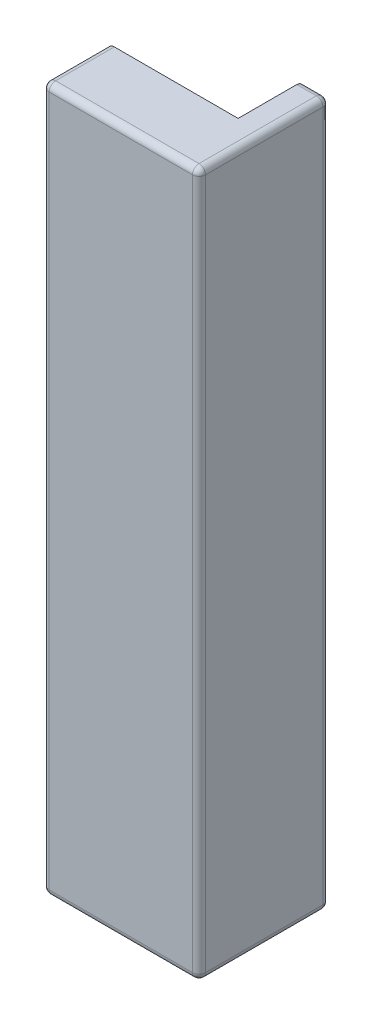
from build123d import *

# Parameters (mm, degrees)
SKETCH_1_W          = 12
SKETCH_1_H          = 54
EXTRUDE_1_DEPTH     = 10
SKETCH_2_W          = 8
SKETCH_2_H          = 50
CUT_EXTRUDE_1_DEPTH = 10
SKETCH_3_W          = 13.565938191
SKETCH_3_H          = 57.788760324
CUT_EXTRUDE_2_DEPTH = 10
SKETCH_4_W          = 3
SKETCH_4_H          = 50
CUT_EXTRUDE_3_DEPTH = 1
FILLET_1_R          = 0.5


with BuildPart() as part:
    # 草圖1 → 填料-伸長1 (new body)
    with BuildSketch(Plane.XY):
        with Locations((-24.897904343, -6.146542517)):
            Rectangle(SKETCH_1_W, SKETCH_1_H)
    extrude(amount=EXTRUDE_1_DEPTH)

    # 草圖2 → 除料-伸長1 (cut)
    with BuildSketch(Plane.ZY.offset(30.897904343)):
        with Locations((4, -6.146542517)):
            Rectangle(SKETCH_2_W, SKETCH_2_H)
    extrude(amount=-CUT_EXTRUDE_1_DEPTH, mode=Mode.SUBTRACT)

    # 草圖3 → 除料-伸長2 (cut)
    with BuildSketch(Plane.ZY.offset(30.897904343)):
        with Locations((-1.782969096, -5.724817648)):
            Rectangle(SKETCH_3_W, SKETCH_3_H)
    extrude(amount=-CUT_EXTRUDE_2_DEPTH, mode=Mode.SUBTRACT)

    # 草圖4 → 除料-伸長3 (cut)
    with BuildSketch(Plane.ZY.offset(20.897904343)):
        with Locations((6.5, -6.146542517)):
            Rectangle(SKETCH_4_W, SKETCH_4_H)
    extrude(amount=-CUT_EXTRUDE_3_DEPTH, mode=Mode.SUBTRACT)

    # 圓角1
    fillet_1_edges = [part.edges().sort_by_distance(p)[0] for p in [
        (-24.897904343, 20.853457483, 10),
        (-30.897904343, -6.146542517, 10),
        (-30.897904343, -6.146542517, 8),
        (-30.897904343, 18.853457483, 6.5),
        (-30.897904343, -31.146542517, 6.5),
        (-19.897904343, 20.853457483, 0),
        (-19.897904343, -33.146542517, 0),
        (-24.897904343, -33.146542517, 10),
        (-18.897904343, -6.146542517, 0),
        (-19.897904343, -6.146542517, 8),
        (-19.897904343, -31.146542517, 6.5),
        (-19.897904343, -6.146542517, 5),
        (-19.897904343, 18.853457483, 6.5),
        (-20.897904343, -6.146542517, 5),
        (-30.897904343, -33.146542517, 7.5),
        (-30.897904343, 20.853457483, 7.5),
        (-18.897904343, 20.853457483, 5),
        (-18.897904343, -33.146542517, 5),
        (-18.897904343, -6.146542517, 10),
    ]]
    fillet(fillet_1_edges, radius=FILLET_1_R - 0.0001)  # a hair under: the kernel refuses the full size


solid = part.part
